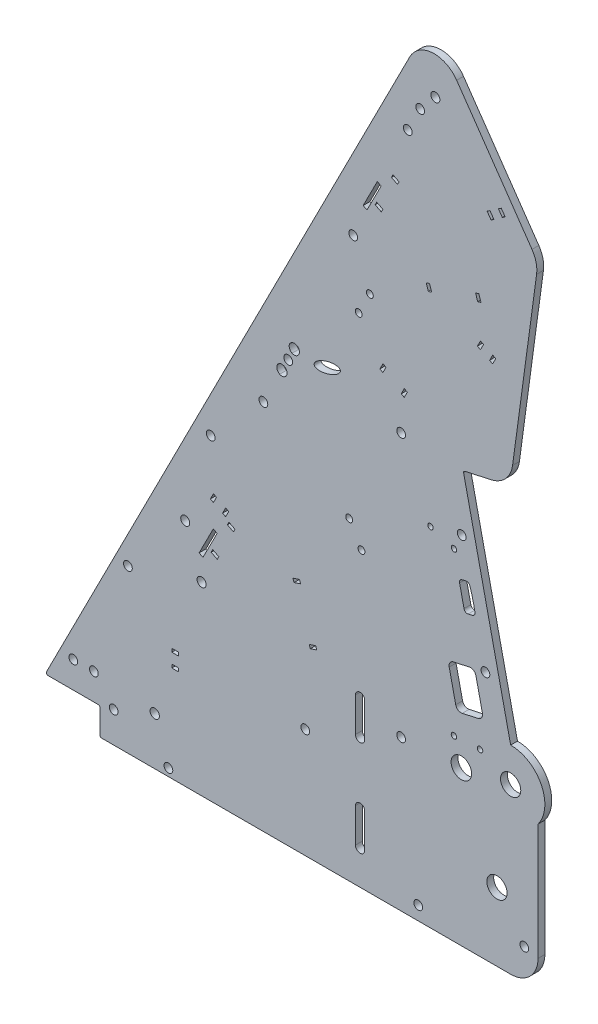
from build123d import *

# Parameters (mm, degrees)
BOSS_EXTRUDE1_DEPTH     = 3.175
SKETCH2_R               = 2.0955
SKETCH2_R_2             = 2.032
SKETCH2_R_3             = 4.699
CUT_EXTRUDE1_DEPTH      = 421.976111717
SKETCH7_R               = 2.159
CUT_EXTRUDE2_DEPTH      = 421.976111717
CUT_EXTRUDE3_REACH      = 422.976
SKETCH10_R              = 2.032
FILLET1_R               = 12.7
FILLET2_R               = 0.79375
SKETCH12_R              = 2.032
CUT_EXTRUDE5_DEPTH      = 411.989226146
CUT_EXTRUDE6_DEPTH      = 411.989226146
CUT_EXTRUDE6_DEPTH_BACK = 411.989226146
SKETCH13_R              = 1.27
SKETCH14_R              = 2.032
SKETCH14_R_2            = 1.6
SKETCH14_RX             = 6.35
SKETCH14_RY             = 2.38125
SKETCH14_W              = 3.175
SKETCH14_H              = 1.5875
CUT_EXTRUDE7_DEPTH      = 411.989226146
SKETCH15_R              = 2.032
CUT_EXTRUDE8_DEPTH      = 411.989226285
FILLET3_R               = 2.54
SKETCH16_R              = 4.7625
CUT_EXTRUDE9_DEPTH      = 411.989226285


with BuildPart() as part:
    # Sketch1 → Boss-Extrude1 (new body)
    with BuildSketch(Plane.XY):
        with BuildLine():
            Line((228.6, -12.7), (228.6, 53.975))
            ThreePointArc((228.6, 53.975), (230.099031657, 70.599515829), (215.9, 79.375))
            Line((215.9, 79.375), (193.909735224, 178.566674323))
            Line((193.909735224, 178.566674323), (215.607913982, 183.377044743))
            Line((215.607913982, 183.377044743), (228.6, 279.4))
            Line((228.6, 279.4), (178.754725958, 351.413083686))
            Line((178.754725958, 351.413083686), (0, 0))
            Line((0, 0), (25.4, 0))
            Line((25.4, 0), (25.4, -12.7))
            Line((25.4, -12.7), (228.6, -12.7))
        make_face()
    extrude(amount=BOSS_EXTRUDE1_DEPTH)

    # Sketch2 → Cut-Extrude1 (cut, through all)
    with BuildSketch(Plane.XY.offset(3.175)):
        with Locations((64.943150167, 94.057839899)):
            Circle(SKETCH2_R)
        with Locations((180.975, 322.164313376)):
            Circle(SKETCH2_R)
        with Locations((72.544547852, 73.173171402)):
            Circle(SKETCH2_R)
        with Locations((193.207821773, 152.394364194)):
            Circle(SKETCH2_R_2)
        with Locations((215.9, 63.5)):
            Circle(SKETCH2_R_3)
        with Locations((173.0375, -6.35)):
            Circle(SKETCH2_R_2)
        with Locations((204.202954161, 102.798527032)):
            Circle(SKETCH2_R_2)
        with Locations((209.55, 19.05)):
            Circle(SKETCH2_R_3)
        with Locations((165.1, 179.3875)):
            Circle(SKETCH2_R_2)
    extrude(amount=-CUT_EXTRUDE1_DEPTH, mode=Mode.SUBTRACT)

    # Sketch7 → Cut-Extrude2 (cut, through all)
    with BuildSketch(Plane.XY.offset(3.175)):
        with Locations((50.8, 9.525)):
            Circle(SKETCH7_R)
        with BuildLine():
            Line((143.891, 3.175), (143.891, 19.05))
            ThreePointArc((143.891, 19.05), (146.05, 21.209), (148.209, 19.05))
            Line((148.209, 19.05), (148.209, 3.175))
            ThreePointArc((148.209, 3.175), (146.05, 1.016), (143.891, 3.175))
        make_face()
        with BuildLine():
            Line((143.891, 47.625), (143.891, 63.5))
            ThreePointArc((143.891, 63.5), (146.05, 65.659), (148.209, 63.5))
            Line((148.209, 63.5), (148.209, 47.625))
            ThreePointArc((148.209, 47.625), (146.05, 45.466), (143.891, 47.625))
        make_face()
    extrude(amount=-CUT_EXTRUDE2_DEPTH, mode=Mode.SUBTRACT)

    # Sketch10 → Cut-Extrude3 (cut, up to next)
    with BuildSketch(Plane.XY.offset(3.175), mode=Mode.PRIVATE) as cut_extrude3_sk1:
        with Locations((165.1, 57.15)):
            Circle(SKETCH10_R)
    cut_extrude3_tool1 = extrude(cut_extrude3_sk1.sketch, amount=-CUT_EXTRUDE3_REACH, mode=Mode.PRIVATE) & part.part
    # Sketch10 → Cut-Extrude3 (cut, up to next)
    with BuildSketch(Plane.XY.offset(3.175), mode=Mode.PRIVATE) as cut_extrude3_sk2:
        with Locations((120.65, 38.1)):
            Circle(SKETCH10_R)
    cut_extrude3_tool2 = extrude(cut_extrude3_sk2.sketch, amount=-CUT_EXTRUDE3_REACH, mode=Mode.PRIVATE) & part.part
    # Sketch10 → Cut-Extrude3 (cut, up to next)
    with BuildSketch(Plane.XY.offset(3.175), mode=Mode.PRIVATE) as cut_extrude3_sk3:
        with Locations((13.046467246, 12.334704411)):
            Circle(SKETCH10_R)
    cut_extrude3_tool3 = extrude(cut_extrude3_sk3.sketch, amount=-CUT_EXTRUDE3_REACH, mode=Mode.PRIVATE) & part.part
    # Sketch10 → Cut-Extrude3 (cut, up to next)
    with BuildSketch(Plane.XY.offset(3.175), mode=Mode.PRIVATE) as cut_extrude3_sk4:
        with Locations((22.571467246, 12.334704411)):
            Circle(SKETCH10_R)
    cut_extrude3_tool4 = extrude(cut_extrude3_sk4.sketch, amount=-CUT_EXTRUDE3_REACH, mode=Mode.PRIVATE) & part.part
    # Sketch10 → Cut-Extrude3 (cut, up to next)
    with BuildSketch(Plane.XY.offset(3.175), mode=Mode.PRIVATE) as cut_extrude3_sk5:
        with Locations((38.360434174, 62.564025462)):
            Circle(SKETCH10_R)
    cut_extrude3_tool5 = extrude(cut_extrude3_sk5.sketch, amount=-CUT_EXTRUDE3_REACH, mode=Mode.PRIVATE) & part.part
    add(cut_extrude3_tool1.solids().sort_by_distance((165.1, 57.15, 3.175))[0], mode=Mode.SUBTRACT)
    add(cut_extrude3_tool2.solids().sort_by_distance((120.65, 38.1, 3.175))[0], mode=Mode.SUBTRACT)
    add(cut_extrude3_tool3.solids().sort_by_distance((13.046467, 12.334704, 3.175))[0], mode=Mode.SUBTRACT)
    add(cut_extrude3_tool4.solids().sort_by_distance((22.571467, 12.334704, 3.175))[0], mode=Mode.SUBTRACT)
    add(cut_extrude3_tool5.solids().sort_by_distance((38.360434, 62.564025, 3.175))[0], mode=Mode.SUBTRACT)

    # Fillet1
    fillet1_edges = [part.edges().sort_by_distance(p)[0] for p in [
        (228.6, -12.7, 1.5875),
        (178.754725958, 351.413083686, 1.5875),
        (215.607913982, 183.377044743, 1.5875),
        (228.6, 279.4, 1.5875),
    ]]
    fillet(fillet1_edges, radius=FILLET1_R)

    # Fillet2
    fillet2_edges = [part.edges().sort_by_distance(p)[0] for p in [
        (25.4, -12.7, 1.5875),
        (25.4, 0, 1.5875),
        (193.909735224, 178.566674323, 1.5875),
        (0, 0, 1.5875),
    ]]
    fillet(fillet2_edges, radius=FILLET2_R)

    # Sketch12 → Cut-Extrude5 (cut, through all)
    with BuildSketch(Plane.XY.offset(3.175)):
        with Locations((31.75, 1.5875)):
            Circle(SKETCH12_R)
        with Locations((222.25, 1.5875)):
            Circle(SKETCH12_R)
        with Locations((57.15, -9.2075)):
            Circle(SKETCH12_R)
    extrude(amount=-CUT_EXTRUDE5_DEPTH, mode=Mode.SUBTRACT)

    # Sketch13 → Cut-Extrude6 (cut, two sides: drawn at the far end of the back side and taken through both)
    with BuildSketch(Plane.XY.offset(3.175).offset(-CUT_EXTRUDE6_DEPTH_BACK)):
        with Locations((189.602197334, 69.980636704)):
            Circle(SKETCH13_R)
        with Locations((201.708862449, 70.509225118)):
            Circle(SKETCH13_R)
        with Locations((178.721644858, 148.532438598)):
            Circle(SKETCH13_R)
        with Locations((189.622629605, 145.09537131)):
            Circle(SKETCH13_R)
        Polygon((186.844411154, 98.950230697), (199.243370445, 101.699013794), (203.36654509, 83.100574858), (190.9675858, 80.351791761), align=None)
        with BuildLine():
            Line((195.12807169, 134.933592333), (193.415301921, 134.553880417))
            ThreePointArc((193.415301921, 134.553880417), (192.420015888, 133.856973634), (192.209029897, 132.660412618))
            Line((192.209029897, 132.660412618), (194.270617219, 123.361193151))
            ThreePointArc((194.270617219, 123.361193151), (194.967524002, 122.365907117), (196.164085018, 122.154921126))
            Line((196.164085018, 122.154921126), (198.109091879, 122.586118766))
            ThreePointArc((198.109091879, 122.586118766), (199.082720469, 123.249946547), (199.330550026, 124.401988414))
            ThreePointArc((199.330550026, 124.401988414), (198.332361402, 129.18494451), (196.979617949, 133.879956193))
            ThreePointArc((196.979617949, 133.879956193), (196.256822614, 134.763465498), (195.12807169, 134.933592333))
        make_face()
    extrude(amount=CUT_EXTRUDE6_DEPTH + CUT_EXTRUDE6_DEPTH_BACK, mode=Mode.SUBTRACT)

    # Sketch14 → Cut-Extrude7 (cut, through all)
    with BuildSketch(Plane.XY.offset(3.175)):
        with Locations((142.875, 247.65)):
            Circle(SKETCH14_R)
        with Locations((112.7125, 182.5625)):
            Circle(SKETCH14_R)
        with Locations((101.196445848, 159.923142748)):
            Circle(SKETCH14_R)
        with Locations((150.594024053, 227.898538502)):
            Circle(SKETCH14_R_2)
        with Locations((145.425401324, 217.737567137)):
            Circle(SKETCH14_R_2)
        with Locations((141.005791302, 132.980522447)):
            Circle(SKETCH14_R_2)
        with Locations((146.705791302, 123.107832844)):
            Circle(SKETCH14_R_2)
        with Locations(Location((130.826142263, 188.461522288), (0, 0, -161.961260538))):
            Ellipse(SKETCH14_RX, SKETCH14_RY)
        Polygon((147.482742003, 261.9243054), (154.04689287, 274.828739034), (155.829519425, 273.921963116), (149.265368558, 261.017529483), align=None)
        Polygon((160.590482388, 279.78010172), (161.310235773, 281.195061549), (164.140155429, 279.75555478), (163.420402045, 278.340594951), align=None)
        Polygon((153.789663007, 266.410402556), (156.619582664, 264.970895787), (155.899829279, 263.555935959), (153.069909623, 264.995442728), align=None)
        Polygon((178.26972852, 245.992253978), (179.240391581, 242.969268992), (177.728899089, 242.483937462), (176.758236028, 245.506922447), align=None)
        Polygon((200.609634347, 249.830809719), (199.638971286, 252.853794704), (201.150463779, 253.339126235), (202.12112684, 250.316141249), align=None)
        Polygon((77.953373051, 97.225512031), (79.735999607, 96.318736114), (73.17184874, 83.41430248), (71.389222185, 84.321078398), align=None)
        Polygon((85.216715955, 103.591834546), (84.49696257, 102.176874718), (87.326882227, 100.737367949), (88.046635611, 102.152327777), align=None)
        Polygon((156.643043941, 199.39992488), (158.08255071, 202.229844536), (156.667590882, 202.949597921), (155.228084113, 200.119678264), align=None)
        Polygon((165.132802911, 195.081404573), (166.57230968, 197.911324229), (167.987269508, 197.191570845), (166.547762739, 194.361651188), align=None)
        Polygon((77.696143189, 88.807175554), (76.976389805, 87.392215725), (79.806309461, 85.952708956), (80.526062846, 87.367668785), align=None)
        Polygon((201.915382504, 234.74968075), (200.475875735, 231.919761094), (201.890835563, 231.200007709), (203.330342332, 234.029927366), align=None)
        Polygon((206.135715047, 229.040747556), (207.575221816, 231.870667212), (208.990181645, 231.150913828), (207.550674876, 228.320994171), align=None)
        Polygon((205.013971437, 288.371538288), (206.820969573, 285.760909487), (208.126283974, 286.664408555), (206.319285837, 289.275037356), align=None)
        Polygon((210.235229039, 291.98553456), (212.042227175, 289.374905759), (213.347541575, 290.278404827), (211.540543439, 292.889033628), align=None)
        Polygon((122.453385221, 73.10367975), (122.951215646, 71.596257739), (125.966059667, 72.591918589), (125.468229242, 74.099340599), align=None)
        Polygon((114.917306673, 95.922796693), (115.415137097, 94.415374682), (118.429981119, 95.411035531), (117.932150694, 96.918457542), align=None)
        with Locations((60.325, 38.89375)):
            Rectangle(SKETCH14_W, SKETCH14_H)
        with Locations((60.325, 32.54375)):
            Rectangle(SKETCH14_W, SKETCH14_H)
        Polygon((78.051560814, 111.424204195), (76.612054045, 108.594284538), (78.027013874, 107.874531154), (79.466520643, 110.70445081), align=None)
        Polygon((82.271893358, 105.715271), (83.711400127, 108.545190657), (85.126359956, 107.825437272), (83.686853187, 104.995517616), align=None)
        with BuildLine():
            add(Edge.make_bspline(
                [(108.753856385, 174.780220945), (110.821723963, 173.728350313), (111.90135404, 175.850790056), (112.980984117, 177.973229798), (110.913116539, 179.025100429)],
                knots=[0, 0, 0, 1.570796327, 1.570796327, 3.141592654, 3.141592654, 3.141592654], degree=2, weights=[1, 0.707106781, 1, 0.707106781, 1]))
            add(Edge.make_bspline(
                [(110.913116539, 179.025100429), (110.77268373, 179.096534959), (110.626511301, 179.154391231), (110.322493118, 179.242488117), (110.165373026, 179.272144601), (109.695542578, 179.315227584), (109.373415846, 179.283109915), (108.9218002, 179.145618276), (108.77365547, 179.084104344), (108.495402792, 178.934315945), (108.365007933, 178.846412483), (108.121928357, 178.644218756), (108.0096946, 178.529696631), (107.813416216, 178.283892413), (107.727754596, 178.151249117), (107.58342172, 177.86715543), (107.526957985, 177.720181494), (107.444132542, 177.416788403), (107.417775942, 177.25846019), (107.397765558, 176.943245973), (107.403605499, 176.786285249), (107.446503964, 176.473637327), (107.48413539, 176.317513381), (107.58741463, 176.020451076), (107.653173274, 175.877669132), (107.813265642, 175.6037409), (107.906595752, 175.474826714), (108.217757093, 175.120973916), (108.473611136, 174.922774438), (108.753856385, 174.780220945)],
                knots=[0, 0, 0, 0, 0.0625, 0.0625, 0.125, 0.125, 0.25, 0.25, 0.3125, 0.3125, 0.375, 0.375, 0.4375, 0.4375, 0.5, 0.5, 0.5625, 0.5625, 0.625, 0.625, 0.6875, 0.6875, 0.75, 0.75, 0.8125, 0.8125, 0.875, 0.875, 1, 1, 1, 1], degree=3))
        make_face()
        with BuildLine():
            add(Edge.make_bspline(
                [(114.511883461, 186.099899571), (116.579751039, 185.048028939), (117.659381116, 187.170468682), (118.739011193, 189.292908424), (116.671143615, 190.344779055)],
                knots=[0, 0, 0, 1.570796327, 1.570796327, 3.141592654, 3.141592654, 3.141592654], degree=2, weights=[1, 0.707106781, 1, 0.707106781, 1]))
            add(Edge.make_bspline(
                [(114.511883461, 186.099899571), (114.371072576, 186.171526418), (114.235866303, 186.257351722), (113.987547839, 186.450065421), (113.872855617, 186.557654504), (113.558328181, 186.915480737), (113.397407635, 187.190062471), (113.24126374, 187.640077887), (113.204646123, 187.792957095), (113.161785412, 188.104373095), (113.155794463, 188.264784445), (113.176022459, 188.579744294), (113.201753482, 188.734678369), (113.28477823, 189.039401247), (113.342554455, 189.189068059), (113.556262174, 189.609540487), (113.758638915, 189.862727621), (114.121215939, 190.164706401), (114.254157477, 190.254446578), (114.53236698, 190.404090785), (114.677524715, 190.464472802), (114.97978581, 190.556739169), (115.136913319, 190.588175808), (115.449881014, 190.619878989), (115.607376248, 190.620744977), (115.924438129, 190.591785045), (116.079517328, 190.562319108), (116.3815103, 190.475083726), (116.53003913, 190.416555249), (116.671143615, 190.344779055)],
                knots=[0, 0, 0, 0, 0.0625, 0.0625, 0.125, 0.125, 0.25, 0.25, 0.3125, 0.3125, 0.375, 0.375, 0.4375, 0.4375, 0.5, 0.5, 0.625, 0.625, 0.6875, 0.6875, 0.75, 0.75, 0.8125, 0.8125, 0.875, 0.875, 0.9375, 0.9375, 1, 1, 1, 1], degree=3))
        make_face()
    extrude(amount=-CUT_EXTRUDE7_DEPTH, mode=Mode.SUBTRACT)

    # Sketch15 → Cut-Extrude8 (cut, through all)
    with BuildSketch(Plane.XY.offset(3.175)):
        with Locations((76.786819993, 134.148053636)):
            Circle(SKETCH15_R)
        with Locations((173.947223848, 313.950707072)):
            Circle(SKETCH15_R)
        with Locations((168.189196772, 302.631028446)):
            Circle(SKETCH15_R)
    extrude(amount=-CUT_EXTRUDE8_DEPTH, mode=Mode.SUBTRACT)

    # Fillet3
    fillet3_edges = [part.edges().sort_by_distance(p)[0] for p in [
        (199.243370445, 101.699013794, 1.5875),
        (186.844411154, 98.950230697, 1.5875),
        (190.9675858, 80.351791761, 1.5875),
        (203.36654509, 83.100574858, 1.5875),
    ]]
    fillet(fillet3_edges, radius=FILLET3_R)

    # Sketch16 → Cut-Extrude9 (cut, through all)
    with BuildSketch(Plane.XY.offset(3.175)):
        with Locations((193.04, 58.801)):
            Circle(SKETCH16_R)
    extrude(amount=-CUT_EXTRUDE9_DEPTH, mode=Mode.SUBTRACT)


solid = part.part
